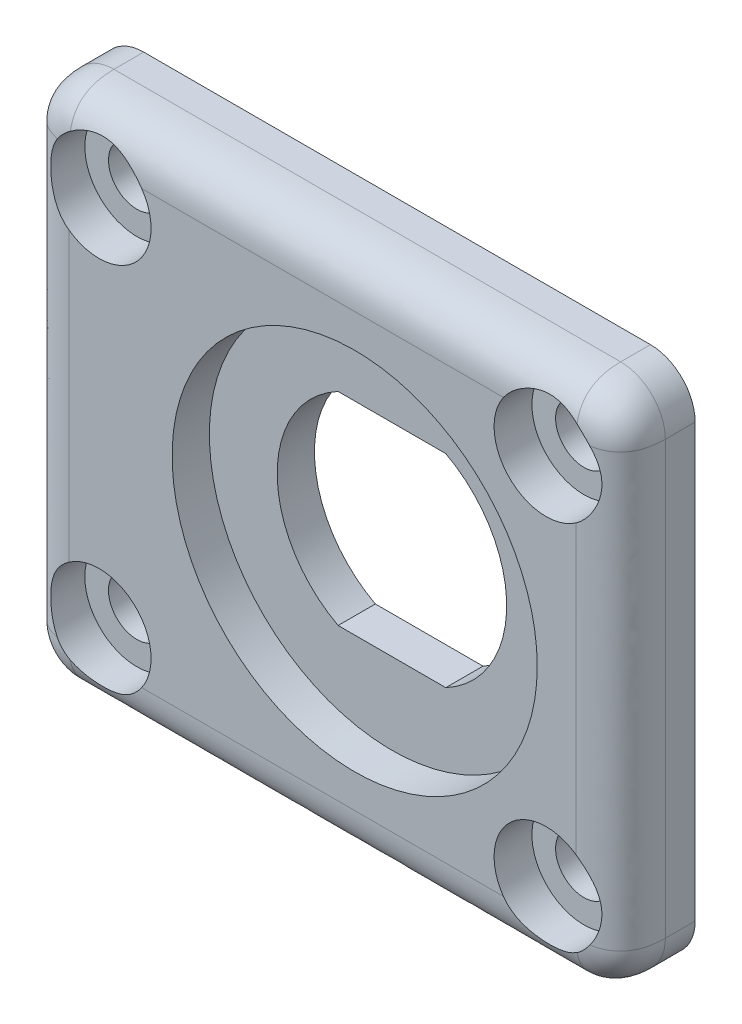
from build123d import *

# Parameters (mm, degrees)
SKETCH1_W           = 40
SKETCH1_H           = 35
BOSS_EXTRUDE1_DEPTH = 5
SKETCH2_R           = 1.905
CUT_EXTRUDE1_DEPTH  = 28.041634566
FILLET1_R           = 3
SKETCH3_R           = 3.4925
CUT_EXTRUDE2_DEPTH  = 2.54
FILLET2_SIZE        = 3
BOSS_EXTRUDE2_DEPTH = 2.5
CUT_EXTRUDE3_REACH  = 29.613
SKETCH9_R           = 12.25
CUT_EXTRUDE5_DEPTH  = 2.5


with BuildPart() as part:
    # Sketch1 → Boss-Extrude1 (new body)
    with BuildSketch(Plane.XY):
        Rectangle(SKETCH1_W, SKETCH1_H)
    extrude(amount=BOSS_EXTRUDE1_DEPTH)

    # Sketch2 → Cut-Extrude1 (cut, through all)
    with BuildSketch(Plane.XY.offset(5)):
        with Locations((-15, 12.5)):
            Circle(SKETCH2_R)
        with Locations(Location((15, 12.5, 0), (0, 0, 180))):
            Circle(SKETCH2_R)
        with Locations((15, -12.5)):
            Circle(SKETCH2_R)
        with Locations(Location((-15, -12.5, 0), (0, 0, 180))):
            Circle(SKETCH2_R)
    extrude(amount=-CUT_EXTRUDE1_DEPTH, mode=Mode.SUBTRACT)

    # Fillet1
    fillet1_edges = [part.edges().sort_by_distance(p)[0] for p in [
        (20, -17.5, 2.5),
        (-20, -17.5, 2.5),
        (-20, 17.5, 2.5),
        (20, 17.5, 2.5),
    ]]
    fillet(fillet1_edges, radius=FILLET1_R)

    # Sketch3 → Cut-Extrude2 (cut)
    with BuildSketch(Plane.XY.offset(5)):
        with Locations((-15, 12.5)):
            Circle(SKETCH3_R)
        with Locations(Location((15, 12.5, 0), (0, 0, 180))):
            Circle(SKETCH3_R)
        with Locations((15, -12.5)):
            Circle(SKETCH3_R)
        with Locations(Location((-15, -12.5, 0), (0, 0, 180))):
            Circle(SKETCH3_R)
    extrude(amount=-CUT_EXTRUDE2_DEPTH, mode=Mode.SUBTRACT)

    # Fillet2
    # a fillet whose section is not a circle: 3 mm, written as the material it takes off along each edge
    with BuildSketch(Plane(origin=(20, 14.5, 5), x_dir=(-1, 0, 0), z_dir=(0, -1, 0)), Plane(origin=(-20, -14.5, 5), x_dir=(1, 0, 0), z_dir=(0, 1, 0))) as fillet2_piece_1:
        with BuildLine():
            Bezier((FILLET2_SIZE, 0), (0, 0), (0, FILLET2_SIZE), weights=[1, 1, 1])
            Line((0, FILLET2_SIZE), (0, 0))
            Line((0, 0), (FILLET2_SIZE, 0))
        make_face()
    extrude(amount=29, mode=Mode.SUBTRACT)
    with BuildSketch(Plane(origin=(-17, 17.5, 5), x_dir=(0, 0, -1), z_dir=(1, 0, 0))) as fillet2_piece_2:
        with BuildLine():
            Bezier((FILLET2_SIZE, 0), (0, 0), (0, -FILLET2_SIZE), weights=[1, 1, 1])
            Line((0, -FILLET2_SIZE), (0, 0))
            Line((0, 0), (FILLET2_SIZE, 0))
        make_face()
    extrude(amount=34, mode=Mode.SUBTRACT)
    with BuildSketch(Plane(origin=(17, -17.5, 5), x_dir=(0, 1, 0), z_dir=(-1, 0, 0))) as fillet2_piece_3:
        with BuildLine():
            Bezier((FILLET2_SIZE, 0), (0, 0), (0, FILLET2_SIZE), weights=[1, 1, 1])
            Line((0, FILLET2_SIZE), (0, 0))
            Line((0, 0), (FILLET2_SIZE, 0))
        make_face()
    extrude(amount=34, mode=Mode.SUBTRACT)
    with BuildSketch(Plane(origin=(-17, -14.5, 5), x_dir=(-1, 0, 0), z_dir=(0, 1, 0))) as fillet2_piece_4:
        with BuildLine():
            Bezier((3 - FILLET2_SIZE, 0), (3, 0), (3, -FILLET2_SIZE), weights=[1, 1, 1])
            Line((3, -FILLET2_SIZE), (3, 0))
            Line((3, 0), (3 - FILLET2_SIZE, 0))
        make_face()
    revolve(axis=Axis((-17, -14.5, 5), (0, 0, 1)), revolution_arc=90, mode=Mode.SUBTRACT)
    with BuildSketch(Plane(origin=(-17, 14.5, 5), x_dir=(0, 1, 0), z_dir=(1, 0, 0))) as fillet2_piece_5:
        with BuildLine():
            Bezier((3, -FILLET2_SIZE), (3, 0), (3 - FILLET2_SIZE, 0), weights=[1, 1, 1])
            Line((3 - FILLET2_SIZE, 0), (3, 0))
            Line((3, 0), (3, -FILLET2_SIZE))
        make_face()
    revolve(axis=Axis((-17, 14.5, 5), (0, 0, 1)), revolution_arc=90, mode=Mode.SUBTRACT)
    with BuildSketch(Plane(origin=(17, -14.5, 5), x_dir=(1, 0, 0), z_dir=(0, 1, 0))) as fillet2_piece_6:
        with BuildLine():
            Bezier((3 - FILLET2_SIZE, 0), (3, 0), (3, FILLET2_SIZE), weights=[1, 1, 1])
            Line((3, FILLET2_SIZE), (3, 0))
            Line((3, 0), (3 - FILLET2_SIZE, 0))
        make_face()
    revolve(axis=Axis((17, -14.5, 5), (0, 0, -1)), revolution_arc=90, mode=Mode.SUBTRACT)
    with BuildSketch(Plane(origin=(17, 14.5, 5), x_dir=(0, 1, 0), z_dir=(-1, 0, 0))) as fillet2_piece_7:
        with BuildLine():
            Bezier((3, FILLET2_SIZE), (3, 0), (3 - FILLET2_SIZE, 0), weights=[1, 1, 1])
            Line((3 - FILLET2_SIZE, 0), (3, 0))
            Line((3, 0), (3, FILLET2_SIZE))
        make_face()
    revolve(axis=Axis((17, 14.5, 5), (0, 0, -1)), revolution_arc=90, mode=Mode.SUBTRACT)

    # Sketch5 → Boss-Extrude2 (add)
    with BuildSketch(Plane(origin=(0, 0, 0), x_dir=(-1, 0, 0), z_dir=(0, 0, -1))):
        with BuildLine():
            Line((-10.5, 12), (10.5, 12))
            ThreePointArc((10.5, 12), (11.671572875, 9.171572875), (14.5, 8))
            Line((14.5, 8), (14.5, -8))
            ThreePointArc((14.5, -8), (11.671572875, -9.171572875), (10.5, -12))
            Line((10.5, -12), (-10.5, -12))
            ThreePointArc((-10.5, -12), (-11.671572875, -9.171572875), (-14.5, -8))
            Line((-14.5, -8), (-14.5, 8))
            ThreePointArc((-14.5, 8), (-11.671572875, 9.171572875), (-10.5, 12))
        make_face()
        with BuildLine():
            Line((-9.601020514, -11), (9.601020514, -11))
            ThreePointArc((9.601020514, -11), (10.964466094, -8.464466094), (13.5, -7.101020514))
            Line((13.5, -7.101020514), (13.5, 7.101020514))
            ThreePointArc((13.5, 7.101020514), (10.964466094, 8.464466094), (9.601020514, 11))
            Line((9.601020514, 11), (-9.601020514, 11))
            ThreePointArc((-9.601020514, 11), (-10.964466094, 8.464466094), (-13.5, 7.101020514))
            Line((-13.5, 7.101020514), (-13.5, -7.101020514))
            ThreePointArc((-13.5, -7.101020514), (-10.964466094, -8.464466094), (-9.601020514, -11))
        make_face(mode=Mode.SUBTRACT)
    extrude(amount=BOSS_EXTRUDE2_DEPTH)

    # Sketch7 → Cut-Extrude3 (cut, up to next)
    with BuildSketch(Plane.XY.offset(5), mode=Mode.PRIVATE) as cut_extrude3_sk1:
        with BuildLine():
            Line((5.767478374, 6.8), (-1.457478374, 6.8))
            ThreePointArc((-1.457478374, 6.8), (-5.545, 0), (-1.457478374, -6.8))
            Line((-1.457478374, -6.8), (5.767478374, -6.8))
            ThreePointArc((5.767478374, -6.8), (9.855, 0), (5.767478374, 6.8))
        make_face()
    cut_extrude3_tool1 = extrude(cut_extrude3_sk1.sketch, amount=-CUT_EXTRUDE3_REACH, mode=Mode.PRIVATE) & part.part
    add(cut_extrude3_tool1.solids().sort_by_distance((2.155, 0, 5))[0], mode=Mode.SUBTRACT)

    # Sketch9 → Cut-Extrude5 (cut)
    with BuildSketch(Plane.XY.offset(5)):
        with Locations((2.155, 0)):
            Circle(SKETCH9_R)
    extrude(amount=-CUT_EXTRUDE5_DEPTH, mode=Mode.SUBTRACT)


solid = part.part
